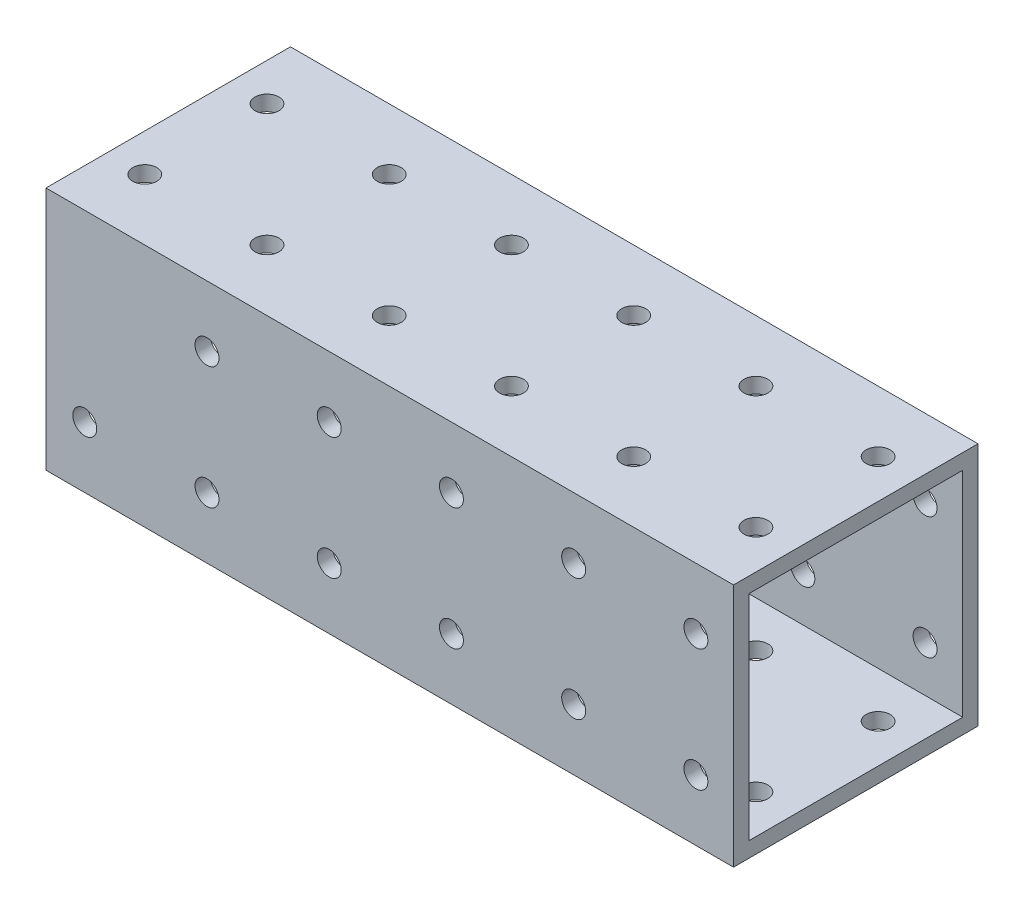
from build123d import *

# Parameters (mm, degrees)
SKETCH1_W           = 50.8
SKETCH1_H           = 50.8
BOSS_EXTRUDE1_DEPTH = 142.875
SHELL1_T            = -3.175
SKETCH2_R           = 2.4892
CUT_EXTRUDE1_DEPTH  = 160.920435295
SKETCH3_R           = 2.4892
CUT_EXTRUDE2_DEPTH  = 160.920435295


with BuildPart() as part:
    # Sketch1 → Boss-Extrude1 (new body)
    with BuildSketch(Plane(origin=(0, 0, 0), x_dir=(0, 0, -1), z_dir=(1, 0, 0))):
        with Locations((25.4, 25.4)):
            Rectangle(SKETCH1_W, SKETCH1_H)
    extrude(amount=BOSS_EXTRUDE1_DEPTH)

    # Shell1
    shell1_openings = [part.faces().sort_by_distance(p)[0] for p in [
        (0, 25.4, -25.4),
        (142.875, 25.4, -25.4),
    ]]
    offset(amount=SHELL1_T, openings=shell1_openings, kind=Kind.INTERSECTION)

    # Sketch2 → Cut-Extrude1 (cut, through all)
    with BuildSketch(Plane(origin=(0, 0, -50.8), x_dir=(-1, 0, 0), z_dir=(0, 0, -1))):
        with Locations((-33.4518, 38.1)):
            Circle(SKETCH2_R)
        with Locations((-58.8518, 38.1)):
            Circle(SKETCH2_R)
        with Locations((-84.2518, 38.1)):
            Circle(SKETCH2_R)
        with Locations((-109.6518, 38.1)):
            Circle(SKETCH2_R)
        with Locations((-135.0518, 38.1)):
            Circle(SKETCH2_R)
        with Locations((-33.4518, 12.7)):
            Circle(SKETCH2_R)
        with Locations((-58.8518, 12.7)):
            Circle(SKETCH2_R)
        with Locations((-84.2518, 12.7)):
            Circle(SKETCH2_R)
        with Locations((-109.6518, 12.7)):
            Circle(SKETCH2_R)
        with Locations((-135.0518, 12.7)):
            Circle(SKETCH2_R)
        with Locations((-8.0518, 12.7)):
            Circle(SKETCH2_R)
    extrude(amount=-CUT_EXTRUDE1_DEPTH, mode=Mode.SUBTRACT)

    # Sketch3 → Cut-Extrude2 (cut, through all)
    with BuildSketch(Plane.XZ):
        with Locations((134.8232, -12.7)):
            Circle(SKETCH3_R)
        with Locations((109.4232, -12.7)):
            Circle(SKETCH3_R)
        with Locations((84.0232, -12.7)):
            Circle(SKETCH3_R)
        with Locations((58.6232, -12.7)):
            Circle(SKETCH3_R)
        with Locations((33.2232, -12.7)):
            Circle(SKETCH3_R)
        with Locations((7.8232, -12.7)):
            Circle(SKETCH3_R)
        with Locations((109.4232, -38.1)):
            Circle(SKETCH3_R)
        with Locations((84.0232, -38.1)):
            Circle(SKETCH3_R)
        with Locations((58.6232, -38.1)):
            Circle(SKETCH3_R)
        with Locations((33.2232, -38.1)):
            Circle(SKETCH3_R)
        with Locations((7.8232, -38.1)):
            Circle(SKETCH3_R)
        with Locations((134.8232, -38.1)):
            Circle(SKETCH3_R)
    extrude(amount=-CUT_EXTRUDE2_DEPTH, mode=Mode.SUBTRACT)


solid = part.part
